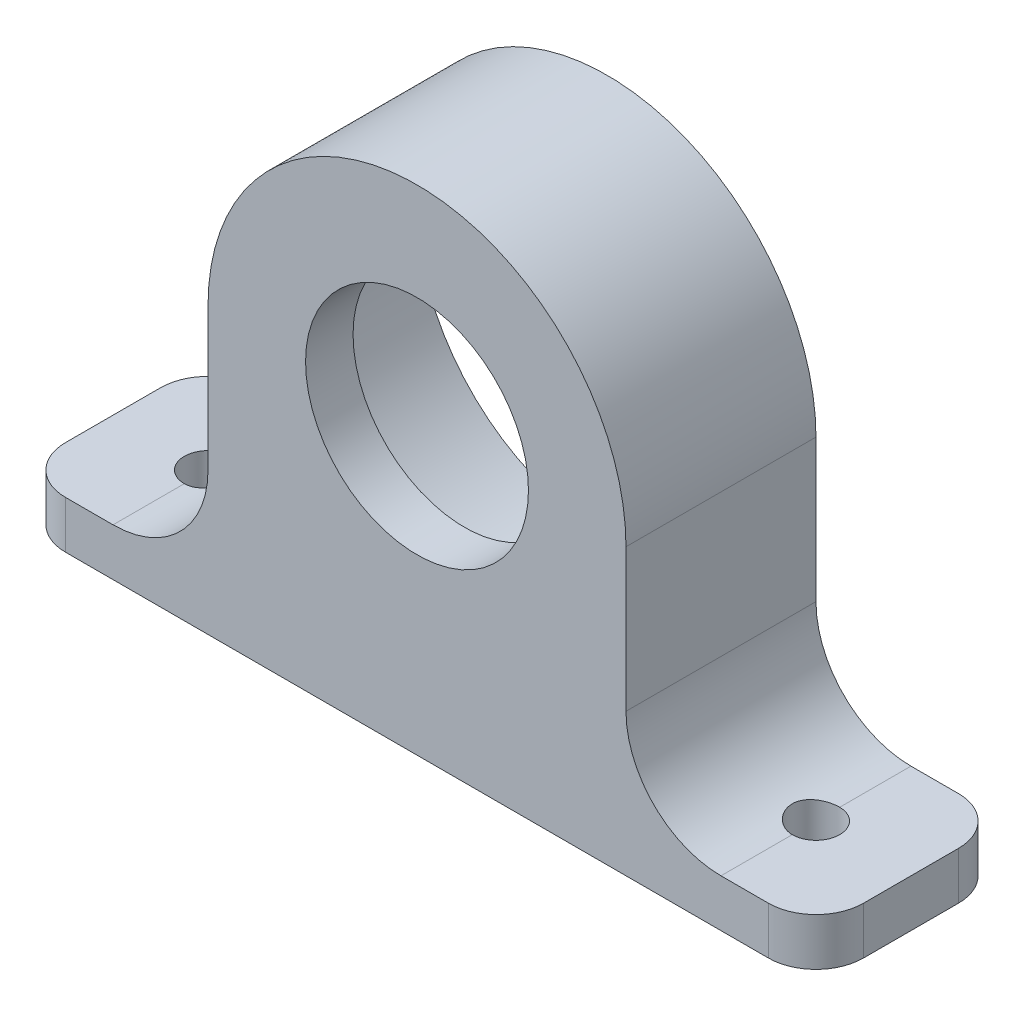
from build123d import *

# Parameters (mm, degrees)
ESQUISSE1_R             = 20
BOSS_EXTRU_1_DEPTH      = 20
ESQUISSE2_R             = 2.5
ENL_V_MAT_EXTRU_1_DEPTH = 15
CONG_1_R                = 10
CONG_2_R                = 5
BOSS_EXTRU_2_START      = -5
ESQUISSE3_R             = 20
ESQUISSE3_R_2           = 11.732748591
BOSS_EXTRU_2_DEPTH      = 5


with BuildPart() as part:
    # Esquisse1 → Boss.-Extru.1 (new body)
    with BuildSketch(Plane.XY):
        with BuildLine():
            Line((42, 0), (-42, 0))
            Line((-42, 0), (-42, 5))
            Line((-42, 5), (-22, 5))
            Line((-22, 5), (-22, 30))
            ThreePointArc((-22, 30), (0, 52), (22, 30))
            Line((22, 30), (22, 5))
            Line((22, 5), (42, 5))
            Line((42, 5), (42, 0))
        make_face()
        with Locations((0, 30)):
            Circle(ESQUISSE1_R, mode=Mode.SUBTRACT)
    extrude(amount=BOSS_EXTRU_1_DEPTH)

    # Esquisse2 → Enlèv. mat.-Extru.1 (cut)
    with BuildSketch(Plane(origin=(0, 5, 0), x_dir=(1, 0, 0), z_dir=(0, 1, 0))):
        with Locations(Location((-32, -10, 0), (0, 0, 180))):
            Circle(ESQUISSE2_R)
        with Locations(Location((32, -10, 0), (0, 0, 180))):
            Circle(ESQUISSE2_R)
    extrude(amount=-ENL_V_MAT_EXTRU_1_DEPTH, mode=Mode.SUBTRACT)

    # Congé1
    # the kernel refuses this fillet: 10 mm, written as the material it adds along each edge
    with BuildSketch(Plane(origin=(-22, 5, 0), x_dir=(-1, 0, 0), z_dir=(0, 0, 1))) as cong_1_piece_1_section:
        with BuildLine():
            CenterArc((CONG_1_R, -CONG_1_R), CONG_1_R, 90, 90)
            Line((0, -CONG_1_R), (0, 0))
            Line((0, 0), (CONG_1_R, 0))
        make_face()
    cong_1_piece_1 = extrude(amount=20, mode=Mode.PRIVATE)
    cong_1_piece_1 = cong_1_piece_1 - Plane(origin=(-32, 7.276430514, 10), x_dir=(-1, 0, 0), z_dir=(0, 1, 0)) * Cylinder(2.5, 81, mode=Mode.PRIVATE)
    add(cong_1_piece_1)
    with BuildSketch(Plane(origin=(22, 5, 0), x_dir=(1, 0, 0), z_dir=(0, 0, 1))) as cong_1_piece_2_section:
        with BuildLine():
            CenterArc((CONG_1_R, CONG_1_R), CONG_1_R, 180, 90)
            Line((0, CONG_1_R), (0, 0))
            Line((0, 0), (CONG_1_R, 0))
        make_face()
    cong_1_piece_2 = extrude(amount=20, mode=Mode.PRIVATE)
    cong_1_piece_2 = cong_1_piece_2 - Plane(origin=(32, 7.276430465, 10), x_dir=(-1, 0, 0), z_dir=(0, 1, 0)) * Cylinder(2.5, 80, mode=Mode.PRIVATE)
    add(cong_1_piece_2)

    # Congé2
    cong_2_edges = [part.edges().sort_by_distance(p)[0] for p in [
        (-42, 2.5, 20),
        (42, 2.5, 20),
        (42, 2.5, 0),
        (-42, 2.5, 0),
    ]]
    fillet(cong_2_edges, radius=CONG_2_R)

    # Esquisse3 → Boss.-Extru.2 (add)
    with BuildSketch(Plane.XY.offset(20).offset(BOSS_EXTRU_2_START)):
        with Locations((0, 30)):
            Circle(ESQUISSE3_R)
        with Locations((0, 30)):
            Circle(ESQUISSE3_R_2, mode=Mode.SUBTRACT)
    extrude(amount=BOSS_EXTRU_2_DEPTH)


solid = part.part
